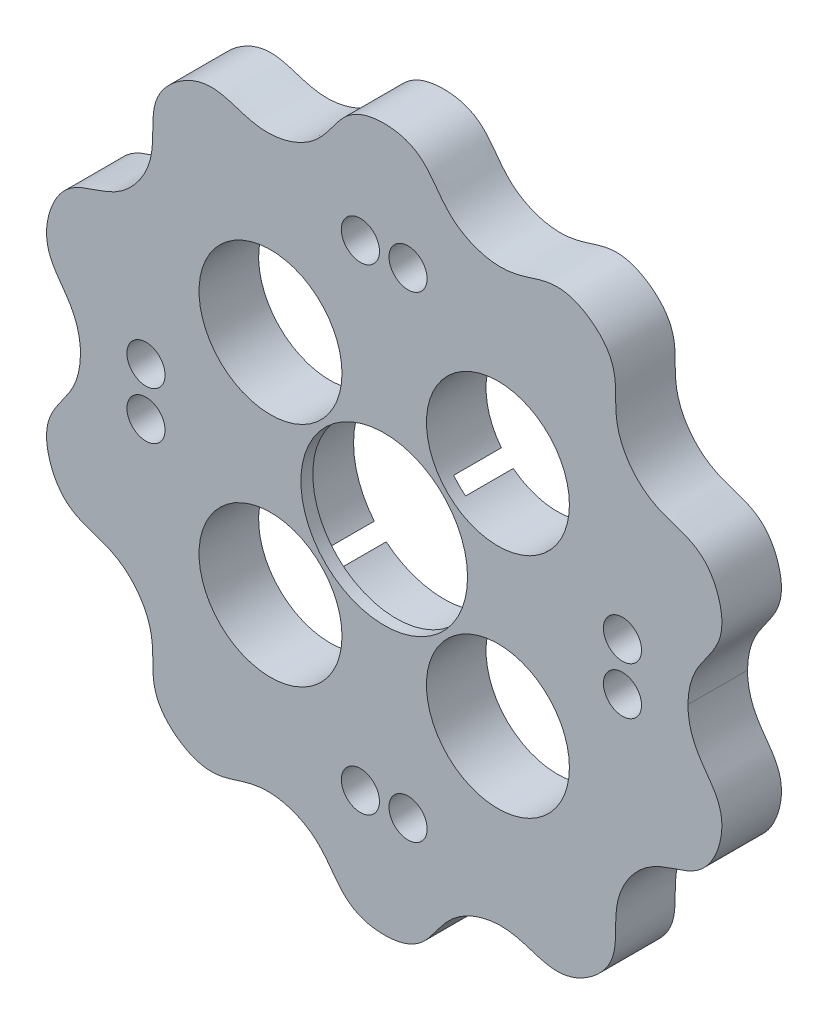
from build123d import *

# Parameters (mm, degrees)
SKETCH3_R                  = 7.5
CYC_DISK_DEPTH             = 5
SKETCH6_R                  = 7.575
CAM_BEARING_DEPTH          = 43.617229285
SKETCH8_R                  = 7.575
SKETCH8_R_2                = 6.995336342
CAM_BEARING_RETAINER_DEPTH = 1
SKETCH9_R                  = 1.6
POSITIONING_HOLES_DEPTH    = 43.617229285
SKETCH11_R                 = 6
OUTPUT_HOLES_DEPTH         = 43.617229285


with BuildPart() as part:
    # Sketch3 → CYC Disk (new body)
    with BuildSketch(Plane.XY.offset(4)):
        with BuildLine():
            add(Edge.make_bspline(
                [(-23.5, 0), (-23.500000004, -0.661850826), (-23.598485334, -1.456071804), (-23.887378462, -2.473353009), (-24.526473508, -3.480254489), (-25.323926988, -4.542764949), (-25.759943157, -5.192186221), (-26.203023639, -6.106999259), (-26.399245523, -6.974680154), (-26.368470738, -8.175748768), (-26.032181523, -9.410596043), (-25.46714701, -10.517898357), (-24.88950703, -11.225581762), (-23.980221887, -11.908283091), (-23.157605578, -12.27234585), (-21.75724169, -12.686961807), (-20.124240836, -13.267572581), (-18.769902135, -14.583261804), (-17.725881209, -16.190526715), (-17.393334278, -18.002161758), (-17.43929245, -19.341809491), (-17.428782036, -20.39238515), (-17.227121316, -21.51798755), (-16.875858121, -22.335292469), (-16.144990379, -23.288888425), (-15.147101673, -24.090235015), (-14.039123179, -24.653942451), (-13.15583675, -24.886942091), (-12.018927843, -24.904794671), (-11.139426548, -24.715805895), (-9.76280322, -24.22812401), (-8.100403327, -23.737994173), (-6.23137758, -24.006348799), (-4.442020297, -24.692993323), (-3.108131817, -25.963170679), (-2.357887579, -27.073981998), (-1.731871597, -27.917737693), (-0.907112157, -28.709835967), (-0.142534485, -29.16458221), (1.009259579, -29.506464264), (2.287588208, -29.568223008), (3.515300557, -29.373018486), (4.366848041, -29.042336417), (5.297120151, -28.388521169), (5.89756683, -27.718668148), (6.724626277, -26.514966324), (7.781444952, -25.141308816), (9.451253436, -24.259826499), (11.302473412, -23.763575766), (13.128203378, -24.007130856), (14.388082228, -24.464813592), (15.39048695, -24.779463326), (16.523315038, -24.935502855), (17.409164503, -24.853992814), (18.541938704, -24.453573642), (19.612429169, -23.752154799), (20.490930983, -22.872599811), (20.985477327, -22.104545345), (21.353780313, -21.028797471), (21.445822153, -20.13394129), (21.40740912, -18.673992713), (21.454977764, -16.941498013), (22.287758898, -15.246875037), (23.493738457, -13.75727996), (25.113943117, -12.881183019), (26.402225679, -12.510917922), (27.398134609, -12.176276192), (28.406329517, -11.63665518), (29.075086389, -11.05002292), (29.756159484, -10.060249035), (30.209920811, -8.863570763), (30.403654258, -7.63562542), (30.352299566, -6.723569256), (30.017954205, -5.636787881), (29.566434352, -4.858733188), (28.677221314, -3.700188592), (27.92348978, -2.600513359), (27.598485315, -1.456071829), (27.499999996, -0.661850826), (27.5, 0)],
                knots=[0.5, 0.5, 0.5, 0.5, 0.5, 0.5, 0.516666667, 0.52, 0.526666667, 0.53, 0.533333333, 0.536666667, 0.546666667, 0.55, 0.56, 0.563333333, 0.566666667, 0.57, 0.58, 0.583333333, 0.6, 0.61, 0.616666667, 0.626666667, 0.63, 0.633333333, 0.636666667, 0.646666667, 0.65, 0.66, 0.663333333, 0.666666667, 0.67, 0.68, 0.683333333, 0.7, 0.71, 0.716666667, 0.726666667, 0.73, 0.733333333, 0.736666667, 0.746666667, 0.75, 0.76, 0.763333333, 0.766666667, 0.77, 0.78, 0.783333333, 0.8, 0.81, 0.816666667, 0.826666667, 0.83, 0.833333333, 0.836666667, 0.846666667, 0.85, 0.86, 0.863333333, 0.866666667, 0.87, 0.88, 0.883333333, 0.9, 0.91, 0.916666667, 0.926666667, 0.93, 0.933333333, 0.936666667, 0.946666667, 0.95, 0.96, 0.963333333, 0.966666667, 0.97, 0.98, 0.983333333, 1, 1, 1, 1, 1, 1], degree=5, weights=[1, 1, 1, 1, 1, 1, 1, 1, 1, 1, 1, 1, 1, 1, 1, 1, 1, 1, 1, 1, 1, 1, 1, 1, 1, 1, 1, 1, 1, 1, 1, 1, 1, 1, 1, 1, 1, 1, 1, 1, 1, 1, 1, 1, 1, 1, 1, 1, 1, 1, 1, 1, 1, 1, 1, 1, 1, 1, 1, 1, 1, 1, 1, 1, 1, 1, 1, 1, 1, 1, 1, 1, 1, 1, 1, 1, 1, 1, 1, 1]))
            add(Edge.make_bspline(
                [(27.5, 0), (27.500000004, 0.661850826), (27.598485335, 1.456071804), (27.887378462, 2.473353009), (28.526473508, 3.480254489), (29.323926988, 4.542764949), (29.759943157, 5.192186221), (30.203023639, 6.106999259), (30.399245523, 6.974680154), (30.368470738, 8.175748768), (30.032181523, 9.410596043), (29.46714701, 10.517898357), (28.88950703, 11.225581762), (27.980221887, 11.908283091), (27.157605578, 12.27234585), (25.75724169, 12.686961807), (24.124240836, 13.267572581), (22.769902135, 14.583261804), (21.725881209, 16.190526715), (21.393334278, 18.002161758), (21.43929245, 19.341809491), (21.428782036, 20.39238515), (21.227121316, 21.51798755), (20.875858121, 22.335292469), (20.144990379, 23.288888425), (19.147101673, 24.090235015), (18.039123179, 24.653942451), (17.15583675, 24.886942091), (16.018927843, 24.904794671), (15.139426548, 24.715805895), (13.76280322, 24.22812401), (12.100403327, 23.737994173), (10.23137758, 24.006348799), (8.442020297, 24.692993323), (7.108131817, 25.963170679), (6.357887579, 27.073981998), (5.731871597, 27.917737693), (4.907112157, 28.709835967), (4.142534485, 29.16458221), (2.990740421, 29.506464264), (1.712411792, 29.568223008), (0.484699443, 29.373018486), (-0.366848041, 29.042336417), (-1.297120151, 28.388521169), (-1.89756683, 27.718668148), (-2.724626277, 26.514966324), (-3.781444952, 25.141308816), (-5.451253436, 24.259826499), (-7.302473412, 23.763575766), (-9.128203378, 24.007130856), (-10.388082228, 24.464813592), (-11.39048695, 24.779463326), (-12.523315038, 24.935502855), (-13.409164503, 24.853992814), (-14.541938704, 24.453573642), (-15.612429169, 23.752154799), (-16.490930983, 22.872599811), (-16.985477327, 22.104545345), (-17.353780313, 21.028797471), (-17.445822153, 20.13394129), (-17.40740912, 18.673992713), (-17.454977764, 16.941498013), (-18.287758898, 15.246875037), (-19.493738457, 13.75727996), (-21.113943117, 12.881183019), (-22.402225679, 12.510917922), (-23.398134609, 12.176276192), (-24.406329517, 11.63665518), (-25.075086389, 11.05002292), (-25.756159484, 10.060249035), (-26.209920811, 8.863570763), (-26.403654258, 7.63562542), (-26.352299566, 6.723569256), (-26.017954205, 5.636787881), (-25.566434352, 4.858733188), (-24.677221314, 3.700188592), (-23.92348978, 2.600513359), (-23.598485314, 1.456071829), (-23.499999996, 0.661850826), (-23.5, 0)],
                knots=[0, 0, 0, 0, 0, 0, 0.016666667, 0.02, 0.026666667, 0.03, 0.033333333, 0.036666667, 0.046666667, 0.05, 0.06, 0.063333333, 0.066666667, 0.07, 0.08, 0.083333333, 0.1, 0.11, 0.116666667, 0.126666667, 0.13, 0.133333333, 0.136666667, 0.146666667, 0.15, 0.16, 0.163333333, 0.166666667, 0.17, 0.18, 0.183333333, 0.2, 0.21, 0.216666667, 0.226666667, 0.23, 0.233333333, 0.236666667, 0.246666667, 0.25, 0.26, 0.263333333, 0.266666667, 0.27, 0.28, 0.283333333, 0.3, 0.31, 0.316666667, 0.326666667, 0.33, 0.333333333, 0.336666667, 0.346666667, 0.35, 0.36, 0.363333333, 0.366666667, 0.37, 0.38, 0.383333333, 0.4, 0.41, 0.416666667, 0.426666667, 0.43, 0.433333333, 0.436666667, 0.446666667, 0.45, 0.46, 0.463333333, 0.466666667, 0.47, 0.48, 0.483333333, 0.5, 0.5, 0.5, 0.5, 0.5, 0.5], degree=5, weights=[1, 1, 1, 1, 1, 1, 1, 1, 1, 1, 1, 1, 1, 1, 1, 1, 1, 1, 1, 1, 1, 1, 1, 1, 1, 1, 1, 1, 1, 1, 1, 1, 1, 1, 1, 1, 1, 1, 1, 1, 1, 1, 1, 1, 1, 1, 1, 1, 1, 1, 1, 1, 1, 1, 1, 1, 1, 1, 1, 1, 1, 1, 1, 1, 1, 1, 1, 1, 1, 1, 1, 1, 1, 1, 1, 1, 1, 1, 1, 1]))
        make_face()
        with Locations((2, 0)):
            Circle(SKETCH3_R, mode=Mode.SUBTRACT)
    extrude(amount=CYC_DISK_DEPTH)

    # Sketch6 → Cam Bearing (cut, through all)
    with BuildSketch(Plane.XY.offset(9)):
        with Locations((2, 0)):
            Circle(SKETCH6_R)
    extrude(amount=-CAM_BEARING_DEPTH, mode=Mode.SUBTRACT)

    # Sketch8 → Cam Bearing Retainer (add)
    with BuildSketch(Plane.XY.offset(9)):
        with Locations((2, 0)):
            Circle(SKETCH8_R)
        with Locations((2, 0)):
            Circle(SKETCH8_R_2, mode=Mode.SUBTRACT)
    extrude(amount=-CAM_BEARING_RETAINER_DEPTH)

    # Sketch9 → Positioning Holes (cut, through all)
    with BuildSketch(Plane.XY.offset(9)):
        with Locations((0, 20)):
            Circle(SKETCH9_R)
        with Locations((4, 20)):
            Circle(SKETCH9_R)
        with Locations((22, -2)):
            Circle(SKETCH9_R)
        with Locations((22, 2)):
            Circle(SKETCH9_R)
        with Locations((0, -20)):
            Circle(SKETCH9_R)
        with Locations((4, -20)):
            Circle(SKETCH9_R)
        with Locations((-18, 2)):
            Circle(SKETCH9_R)
        with Locations((-18, -2)):
            Circle(SKETCH9_R)
    extrude(amount=-POSITIONING_HOLES_DEPTH, mode=Mode.SUBTRACT)

    # Sketch11 → Output Holes (cut, through all)
    with BuildSketch(Plane.XY.offset(9)):
        with Locations((11.545941546, 9.545941546)):
            Circle(SKETCH11_R)
        with Locations((11.545941546, -9.545941546)):
            Circle(SKETCH11_R)
        with Locations((-7.545941546, -9.545941546)):
            Circle(SKETCH11_R)
        with Locations((-7.545941546, 9.545941546)):
            Circle(SKETCH11_R)
    extrude(amount=-OUTPUT_HOLES_DEPTH, mode=Mode.SUBTRACT)


solid = part.part
